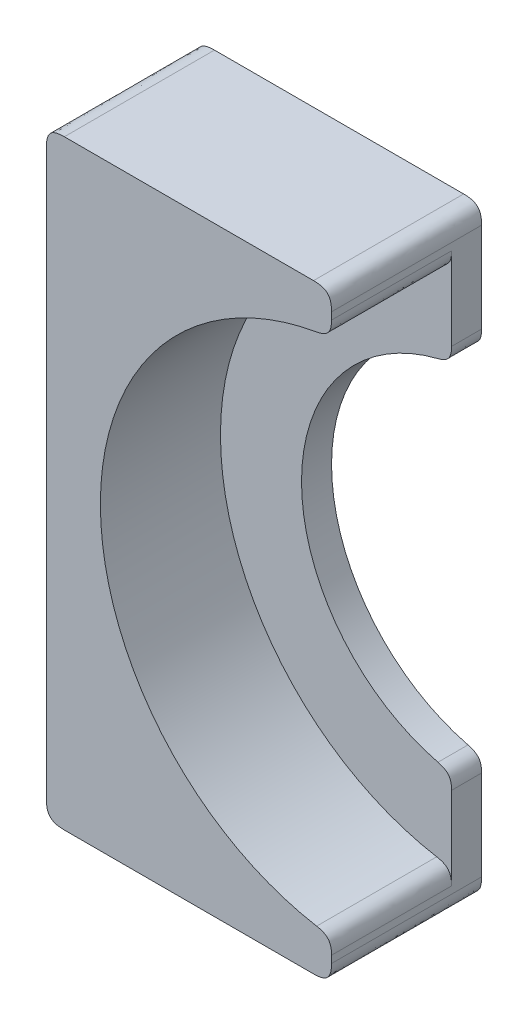
from build123d import *

# Parameters (mm, degrees)
BOSS_EXTRUDE1_DEPTH = 25
BOSS_EXTRUDE2_DEPTH = 5
FILLET1_SIZE        = 3


with BuildPart() as part:
    # Sketch1 → Boss-Extrude1 (new body)
    with BuildSketch(Plane.XY):
        with BuildLine():
            Line((-5, 50), (-52.5, 50))
            Line((-52.5, 50), (-52.5, -50))
            Line((-52.5, -50), (-5, -50))
            Line((-5, -50), (-5, -43.211688234))
            ThreePointArc((-5, -43.211688234), (-43.5, 0), (-5, 43.211688234))
            Line((-5, 43.211688234), (-5, 50))
        make_face()
    extrude(amount=BOSS_EXTRUDE1_DEPTH)

    # Sketch1<3> → Boss-Extrude2 (add)
    with BuildSketch(Plane.XY):
        with BuildLine():
            Line((-5, 29.580398915), (-5, 43.211688234))
            ThreePointArc((-5, 43.211688234), (-43.5, 0), (-5, -43.211688234))
            Line((-5, -43.211688234), (-5, -29.580398915))
            ThreePointArc((-5, -29.580398915), (-30, 0), (-5, 29.580398915))
        make_face()
    extrude(amount=BOSS_EXTRUDE2_DEPTH)

    # Fillet1
    # a fillet whose section is not a circle: 3 mm, written as the material it takes off along each edge
    with BuildSketch(Plane(origin=(-52.5, -50, -7.5), x_dir=(1, 0, 0), z_dir=(0, 0, 1)), Plane(origin=(-52.5, 50, -7.5), x_dir=(0, -1, 0), z_dir=(0, 0, 1)), Plane(origin=(-5, -50, -7.5), x_dir=(0, 1, 0), z_dir=(0, 0, 1))) as fillet1_piece_1:
        with BuildLine():
            Bezier((FILLET1_SIZE, 0), (0, 0), (0, FILLET1_SIZE), weights=[1, 1.222222222, 1])
            Line((0, FILLET1_SIZE), (0, 0))
            Line((0, 0), (FILLET1_SIZE, 0))
        make_face()
    extrude(amount=40, mode=Mode.SUBTRACT)
    with BuildSketch(Plane(origin=(-5, 50, -7.5), x_dir=(0, -1, 0), z_dir=(0, 0, 1))) as fillet1_piece_2:
        with BuildLine():
            Bezier((FILLET1_SIZE, 0), (0, 0), (0, -FILLET1_SIZE), weights=[1, 1.222222222, 1])
            Line((0, -FILLET1_SIZE), (0, 0))
            Line((0, 0), (FILLET1_SIZE, 0))
        make_face()
    extrude(amount=40, mode=Mode.SUBTRACT)
    with BuildSketch(Plane(origin=(-5, 43.211688234, 5), x_dir=(0, 1, 0), z_dir=(0, 0, 1))) as fillet1_piece_3:
        with BuildLine():
            Bezier((2.594970671, 0), (0.073503208, 0), (-0.360297645, 2.483870968), weights=[1, 1.222222222, 1])
            ThreePointArc((-0.360297645, 2.483870968), (-0.162230771, 1.244534585), (0, 0))
            Line((0, 0), (2.594970671, 0))
        make_face()
    extrude(amount=26.487426677, mode=Mode.SUBTRACT)
    with BuildSketch(Plane(origin=(-5, -43.211688234, 5), x_dir=(0, -1, 0), z_dir=(0, 0, 1))) as fillet1_piece_4:
        with BuildLine():
            Bezier((2.594970671, 0), (0.073503208, 0), (-0.360297645, -2.483870968), weights=[1, 1.222222222, 1])
            ThreePointArc((-0.360297645, -2.483870968), (-0.162230771, -1.244534585), (0, 0))
            Line((0, 0), (2.594970671, 0))
        make_face()
    extrude(amount=26.487426677, mode=Mode.SUBTRACT)
    with BuildSketch(Plane(origin=(-5, 29.580398915, -6.088055679), x_dir=(0, 1, 0), z_dir=(0, 0, 1))) as fillet1_piece_5:
        with BuildLine():
            Bezier((2.435222272, 0), (0.092615843, 0), (-0.475288745, 2.272727273), weights=[1, 1.222222222, 1])
            ThreePointArc((-0.475288745, 2.272727273), (-0.215648508, 1.140963567), (0, 0))
            Line((0, 0), (2.435222272, 0))
        make_face()
    extrude(amount=17.176111358, mode=Mode.SUBTRACT)
    with BuildSketch(Plane(origin=(-5, -29.580398915, -6.088055679), x_dir=(0, -1, 0), z_dir=(0, 0, 1))) as fillet1_piece_6:
        with BuildLine():
            Bezier((2.435222272, 0), (0.092615843, 0), (-0.475288745, -2.272727273), weights=[1, 1.222222222, 1])
            ThreePointArc((-0.475288745, -2.272727273), (-0.215648508, -1.140963567), (0, 0))
            Line((0, 0), (2.435222272, 0))
        make_face()
    extrude(amount=17.176111358, mode=Mode.SUBTRACT)


solid = part.part
